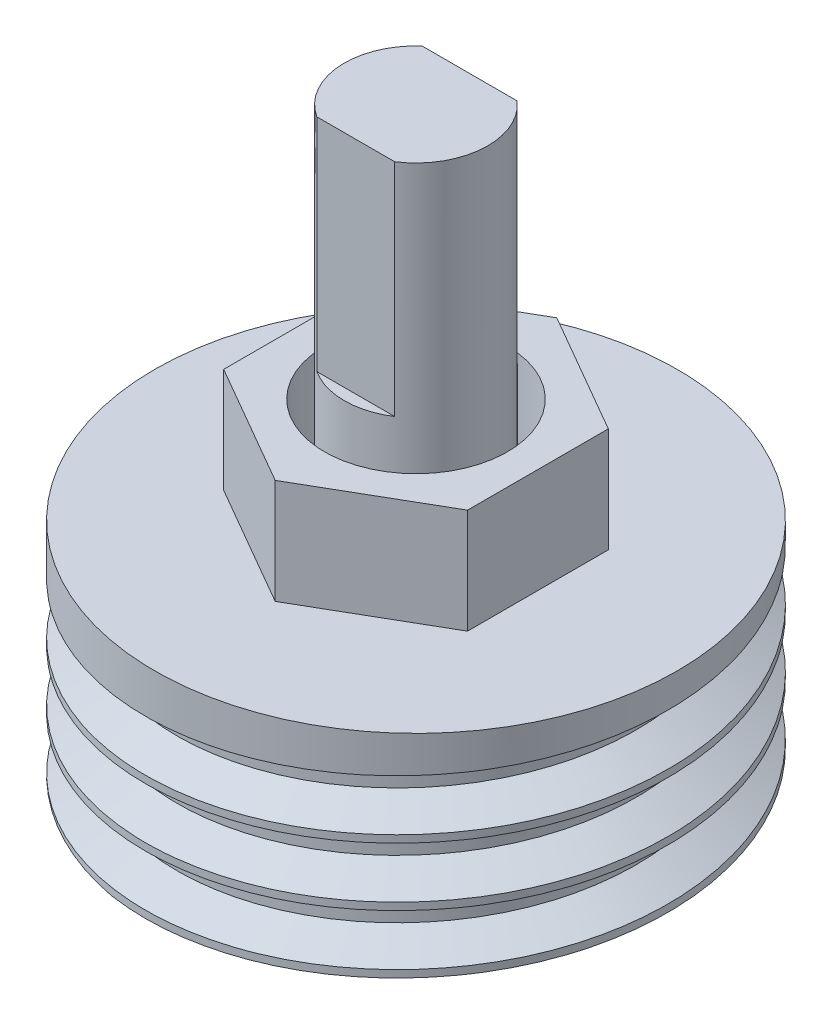
from build123d import *
from build123d.topology import SkipClean

# Parameters (mm, degrees)
BOSS_EXTRUDE1_DEPTH = 8
BOSS_EXTRUDE2_START = 5.0500102
SKETCH2_R           = 2.6
BOSS_EXTRUDE2_DEPTH = 5.0500102
SKETCH3_R           = 9.47
BOSS_EXTRUDE3_DEPTH = 8
THREAD1_PITCH       = 2.116666667
SKETCH8_R           = 3.315
BOSS_EXTRUDE4_DEPTH = 3.8


with BuildPart() as part:
    # Sketch1 → Boss-Extrude1 (new body)
    with BuildSketch(Plane(origin=(0, 0, 0), x_dir=(1, 0, 0), z_dir=(0, 1, 0))):
        with BuildLine():
            Line((-1.725, 1.945347013), (1.725, 1.945347013))
            ThreePointArc((1.725, 1.945347013), (2.592456696, -0.197909772), (1.409713207, -2.184652987))
            Line((1.409713207, -2.184652987), (-1.409713207, -2.184652987))
            ThreePointArc((-1.409713207, -2.184652987), (-2.592456696, -0.197909772), (-1.725, 1.945347013))
        make_face()
    extrude(amount=BOSS_EXTRUDE1_DEPTH)

    # Sketch2 → Boss-Extrude2 (add)
    with BuildSketch(Plane.XZ.offset(BOSS_EXTRUDE2_START)):
        with Locations(Location((0, 0, 0), (0, 0, 270))):
            Circle(SKETCH2_R)
    extrude(amount=-BOSS_EXTRUDE2_DEPTH)



with BuildPart() as body_2:
    # Sketch3 → Boss-Extrude3 (new body)
    with BuildSketch(Plane.XZ.offset(5.0500102)):
        with Locations(Location((0, 0, 0), (0, 0, 270))):
            Circle(SKETCH3_R)
    extrude(amount=BOSS_EXTRUDE3_DEPTH)

    # Thread1: the profile of Thread Profile1 profile screwed along a right-hand helix of 3.779528 turns, 10 arcs to a turn; built about Z, then put on its axis
    with SkipClean():  # the faces are left unmerged after this step: merging them gives an invalid solid
        thread1_z = Axis((0, 0, 0), (0, 0, 1))
        thread1_corners = [(9.4703, 0, -0.000173205), (9.4703, 0, 1.852256533), (8.324320565, 0, 1.190624997), (8.324320565, 0, 0.66145833)]
        with BuildLine(mode=Mode.PRIVATE) as thread1_profile:
            Line(thread1_corners[0], thread1_corners[1])
            Line(thread1_corners[1], thread1_corners[2])
            Line(thread1_corners[2], thread1_corners[3])
            Line(thread1_corners[3], thread1_corners[0])
        thread1_cap = Face(thread1_profile.wire())
        thread1_turn_angles = [0, 18, 36, 54, 72, 90, 108, 126, 144, 162, 180, 198, 216, 234, 252, 270, 288, 306, 324, 342, 360]
        thread1_turn_weights = [1, 0.9510565162951535, 1, 0.9510565162951535, 1, 0.9510565162951535, 1, 0.9510565162951535, 1, 0.9510565162951535, 1, 0.9510565162951535, 1, 0.9510565162951535, 1, 0.9510565162951535, 1, 0.9510565162951535, 1, 0.9510565162951535, 1]
        thread1_turn_rails = [Edge.make_bspline([Vector(p[0], p[1], 0).rotate(thread1_z, thread1_turn_angles[k]) / thread1_turn_weights[k] + Vector(0, 0, p[2] + THREAD1_PITCH * thread1_turn_angles[k] / 360) for k in range(21)], [0, 0, 0, 1, 1, 2, 2, 3, 3, 4, 4, 5, 5, 6, 6, 7, 7, 8, 8, 9, 9, 10, 10, 10], 2, thread1_turn_weights) for p in thread1_corners]
        thread1_turn_sides = [Face.make_surface_from_curves(thread1_turn_rails[p[0]], thread1_turn_rails[p[1]]) for p in [(0, 1), (1, 2), (2, 3), (3, 0)]]
        thread1_last_angles = [1080, 1098, 1116, 1134, 1152, 1170, 1188, 1206, 1224, 1242, 1260, 1278, 1296, 1314, 1332, 1346.31496063, 1360.62992126]
        thread1_last_weights = [1, 0.9510565162951535, 1, 0.9510565162951535, 1, 0.9510565162951535, 1, 0.9510565162951535, 1, 0.9510565162951535, 1, 0.9510565162951535, 1, 0.9510565162951535, 1, 0.9689512039060124, 1]
        thread1_last_rails = [Edge.make_bspline([Vector(p[0], p[1], 0).rotate(thread1_z, thread1_last_angles[k]) / thread1_last_weights[k] + Vector(0, 0, p[2] + THREAD1_PITCH * thread1_last_angles[k] / 360) for k in range(17)], [0, 0, 0, 1, 1, 2, 2, 3, 3, 4, 4, 5, 5, 6, 6, 7, 7, 8, 8, 8], 2, thread1_last_weights) for p in thread1_corners]
        thread1_last_sides = [Face.make_surface_from_curves(thread1_last_rails[p[0]], thread1_last_rails[p[1]]) for p in [(0, 1), (1, 2), (2, 3), (3, 0)]]
        thread1 = Plane(origin=(0, -5.0500102, 0), x_dir=(-1, 0, 0), z_dir=(0, -1, 0)) * Solid(Shell([*[p.moved(Location((0, 0, THREAD1_PITCH * i))) for i in range(3) for p in thread1_turn_sides], *thread1_last_sides, thread1_cap, thread1_cap.rotate(thread1_z, 1360.62992126).moved(Location((0, 0, THREAD1_PITCH * 1360.62992126 / 360)))]))
        add(thread1, mode=Mode.SUBTRACT)


with BuildPart() as part_1:
    with SkipClean():  # the faces are left unmerged after this step: merging them gives an invalid solid
        add(part.part)

        add(body_2.part)  # Boss-Extrude4 merges body 2
        # Sketch8 → Boss-Extrude4 (add)
        with BuildSketch(Plane(origin=(0, -5.0500102, 0), x_dir=(1, 0, 0), z_dir=(0, 1, 0))):
            Polygon((0, 5.10377638), (-4.42, 2.55188819), (-4.42, -2.55188819), (0, -5.10377638), (4.42, -2.55188819), (4.42, 2.55188819), align=None)
            with Locations(Location((0, 0, 0), (0, 0, 90))):
                Circle(SKETCH8_R, mode=Mode.SUBTRACT)
        extrude(amount=BOSS_EXTRUDE4_DEPTH)


solid = part_1.part
